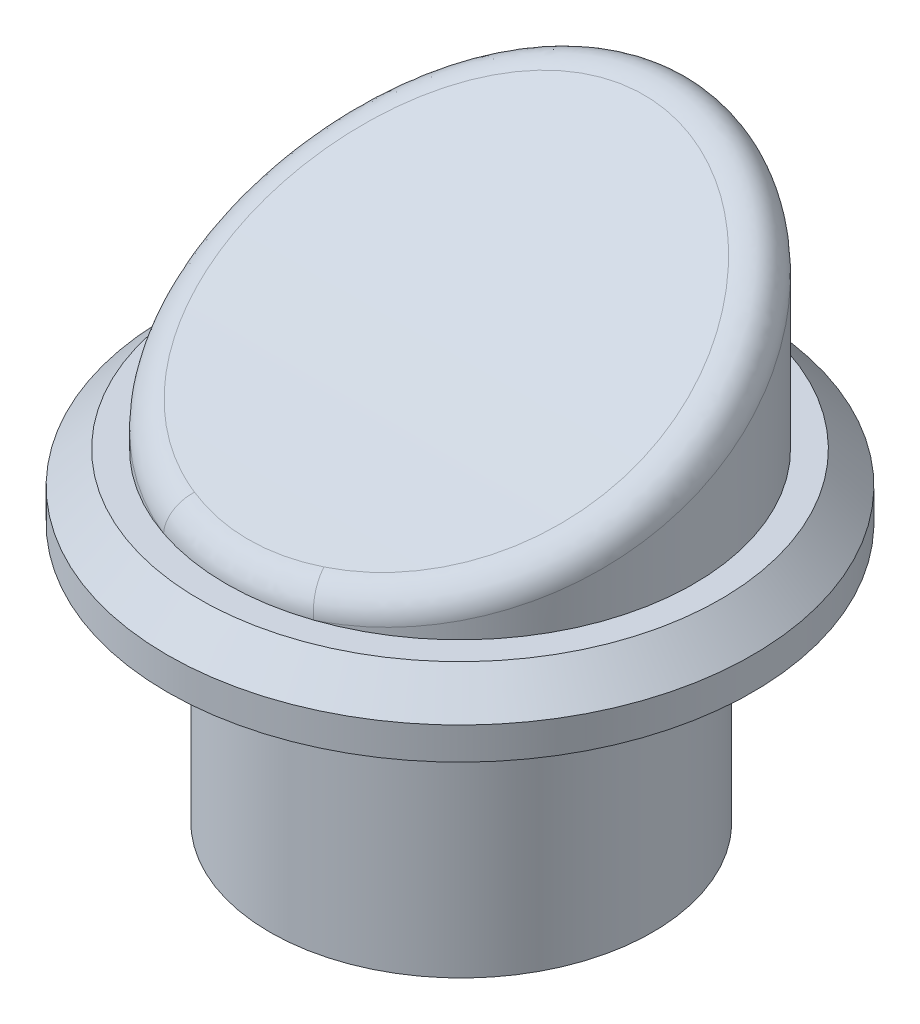
from build123d import *

# Parameters (mm, degrees)
BOSS_EXTRUDE1_DEPTH      = 10
BOSS_EXTRUDE1_DEPTH_BACK = 10
SKETCH2_W                = 18.670227648
SKETCH2_H                = 19.140977346
CUT_EXTRUDE1_DEPTH       = 20
SKETCH5_W                = 18.670227648
SKETCH5_H                = 19.140977346
SKETCH5_R                = 9.102447132
CUT_EXTRUDE3_DEPTH       = 20
SKETCH1_W                = 18.670227648
SKETCH1_H                = 19.140977346
SKETCH1_R                = 5.95
CUT_EXTRUDE4_DEPTH       = 20
BOSS_EXTRUDE2_START      = 2
SKETCH6_R                = 9.102447132
BOSS_EXTRUDE2_DEPTH      = 2
CUT_EXTRUDE8_START       = -2
SKETCH7_R                = 9.102447132
SKETCH7_R_2              = 7.269706681
CUT_EXTRUDE8_DEPTH       = 15.997829572
CHAMFER1_SIZE            = 1
FILLET1_R                = 1


with BuildPart() as part:
    # Sketch2 → Boss-Extrude1 (new, two sides: drawn at the far end of the back side and taken through both)
    with BuildSketch(Plane(origin=(0, 0, 0), x_dir=(1, 0, 0), z_dir=(0, 1, 0)).offset(-BOSS_EXTRUDE1_DEPTH_BACK)):
        Rectangle(SKETCH2_W, SKETCH2_H)
    extrude(amount=BOSS_EXTRUDE1_DEPTH + BOSS_EXTRUDE1_DEPTH_BACK)

    # Sketch3 → Cut-Extrude1 (cut)
    with BuildSketch(Plane.ZY.offset(9.335113824)):
        with BuildLine():
            add(Edge.make_bspline(
                [(9.570488673, 0), (-1.016302409, 2.650123372), (-9.570488673, 9.469116312)],
                knots=[0, 0, 0, 1, 1, 1], degree=2))
            Line((9.570488673, 0), (9.570488673, 10))
            Line((9.570488673, 10), (-9.570488673, 10))
            Line((-9.570488673, 10), (-9.570488673, 9.469116312))
        make_face()
    extrude(amount=-CUT_EXTRUDE1_DEPTH, mode=Mode.SUBTRACT)

    # Sketch5 → Cut-Extrude3 (cut)
    with BuildSketch(Plane.XZ.offset(10)):
        Rectangle(SKETCH5_W, SKETCH5_H)
        Circle(SKETCH5_R, mode=Mode.SUBTRACT)
    extrude(amount=-CUT_EXTRUDE3_DEPTH, mode=Mode.SUBTRACT)

    # Sketch1 → Cut-Extrude4 (cut)
    with BuildSketch(Plane(origin=(0, 0, 0), x_dir=(1, 0, 0), z_dir=(0, 1, 0))):
        Rectangle(SKETCH1_W, SKETCH1_H)
        with Locations((0.062955131, -0.023510844)):
            Circle(SKETCH1_R, mode=Mode.SUBTRACT)
    extrude(amount=-CUT_EXTRUDE4_DEPTH, mode=Mode.SUBTRACT)

    # Sketch6 → Boss-Extrude2 (add)
    with BuildSketch(Plane.XZ.offset(BOSS_EXTRUDE2_START)):
        Circle(SKETCH6_R)
    extrude(amount=-BOSS_EXTRUDE2_DEPTH)

    # Sketch7 → Cut-Extrude8 (cut, through all)
    with BuildSketch(Plane.XZ.offset(2).offset(CUT_EXTRUDE8_START)):
        Circle(SKETCH7_R)
        Circle(SKETCH7_R_2, mode=Mode.SUBTRACT)
    extrude(amount=-CUT_EXTRUDE8_DEPTH, mode=Mode.SUBTRACT)

    # Chamfer1
    chamfer1_edges = [part.edges().sort_by_distance(p)[0] for p in [
        (-9.102447132, 0, 0),
    ]]
    chamfer(chamfer1_edges, length=CHAMFER1_SIZE)

    # Fillet1
    fillet1_edges = [part.edges().sort_by_distance(p)[0] for p in [
        (-7.258384669, 3.641742437, -0.40557114),
    ]]
    fillet(fillet1_edges, radius=FILLET1_R)


solid = part.part
